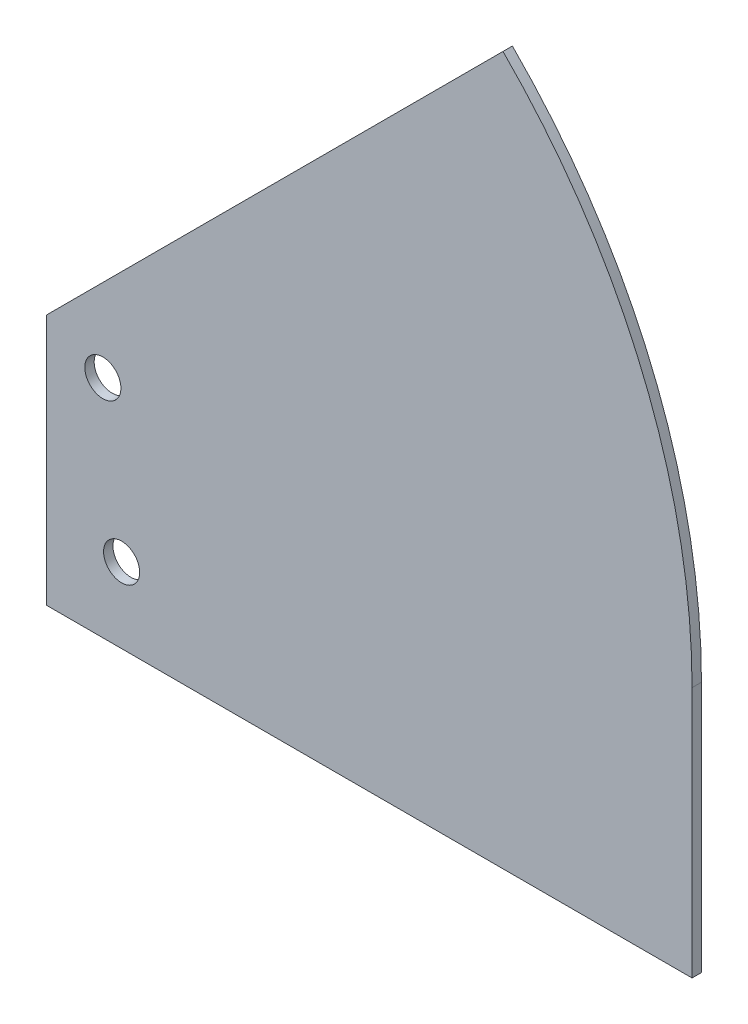
from build123d import *

# Parameters (mm, degrees)
SKETCH1_R           = 6.1087
BOSS_EXTRUDE1_DEPTH = 3.175
SKETCH2_R           = 6.1087
CUT_EXTRUDE1_DEPTH  = 3.175


with BuildPart() as part:
    # Sketch1 → Boss-Extrude1 (new body)
    with BuildSketch(Plane.XY):
        with BuildLine():
            Line((0, 0), (218.44, 0))
            Line((218.44, 0), (218.44, 85.09))
            ThreePointArc((218.44, 85.09), (201.812245082, 168.683368966), (154.460405282, 239.550405282))
            Line((154.460405282, 239.550405282), (0, 85.09))
            Line((0, 85.09), (0, 0))
        make_face()
        with Locations((19.05, 76.2)):
            Circle(SKETCH1_R, mode=Mode.SUBTRACT)
    extrude(amount=BOSS_EXTRUDE1_DEPTH)

    # Sketch2 → Cut-Extrude1 (cut)
    with BuildSketch(Plane.XY.offset(3.175)):
        with Locations((25.4, 25.4)):
            Circle(SKETCH2_R)
    extrude(amount=-CUT_EXTRUDE1_DEPTH, mode=Mode.SUBTRACT)


solid = part.part
